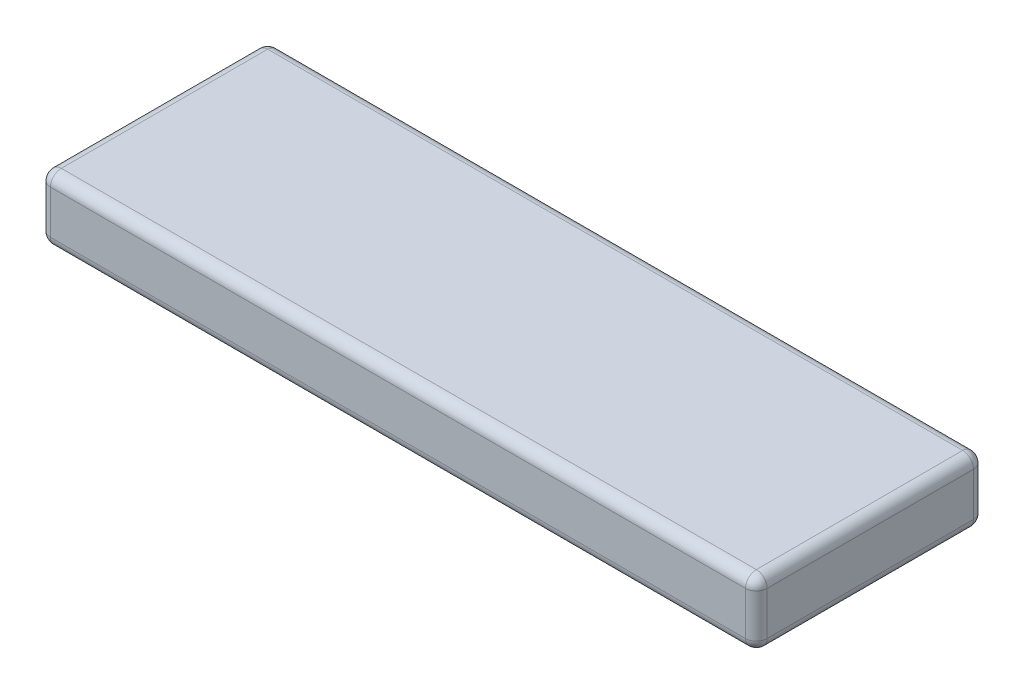
from build123d import *

# Parameters (mm, degrees)
SKETCH1_W           = 132
SKETCH1_H           = 42
BOSS_EXTRUDE1_DEPTH = 12
FILLET1_R           = 2


with BuildPart() as part:
    # Sketch1 → Boss-Extrude1 (new body)
    with BuildSketch(Plane(origin=(0, 0, 0), x_dir=(1, 0, 0), z_dir=(0, 1, 0))):
        Rectangle(SKETCH1_W, SKETCH1_H)
    extrude(amount=BOSS_EXTRUDE1_DEPTH)

    # Fillet1
    fillet1_edges = [part.edges().sort_by_distance(p)[0] for p in [
        (-66, 0, 0),
        (66, 0, 0),
        (66, 6, -21),
        (-66, 6, -21),
        (0, 0, -21),
        (-66, 6, 21),
        (66, 6, 21),
        (0, 0, 21),
        (0, 12, 21),
        (-66, 12, 0),
        (0, 12, -21),
        (66, 12, 0),
    ]]
    fillet(fillet1_edges, radius=FILLET1_R)


solid = part.part
